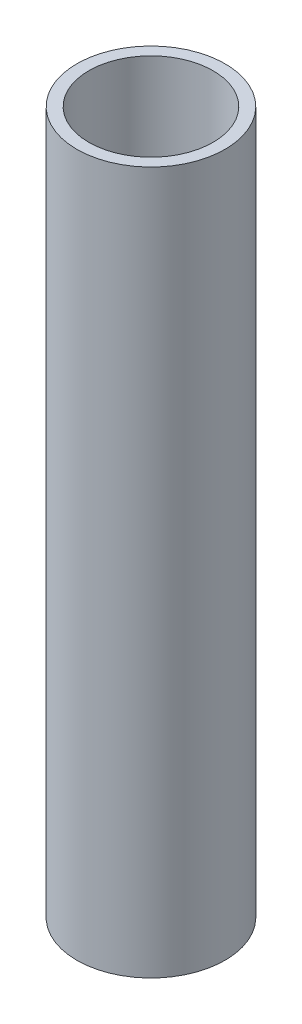
from build123d import *

# Parameters (mm, degrees)
SKETCH1_R           = 24.13
SKETCH1_R_2         = 20.2184
BOSS_EXTRUDE1_DEPTH = 228.6


with BuildPart() as part:
    # Sketch1 → Boss-Extrude1 (new body)
    with BuildSketch(Plane(origin=(0, 0, 0), x_dir=(1, 0, 0), z_dir=(0, 1, 0))):
        Circle(SKETCH1_R)
        Circle(SKETCH1_R_2, mode=Mode.SUBTRACT)
    extrude(amount=-BOSS_EXTRUDE1_DEPTH)


solid = part.part
